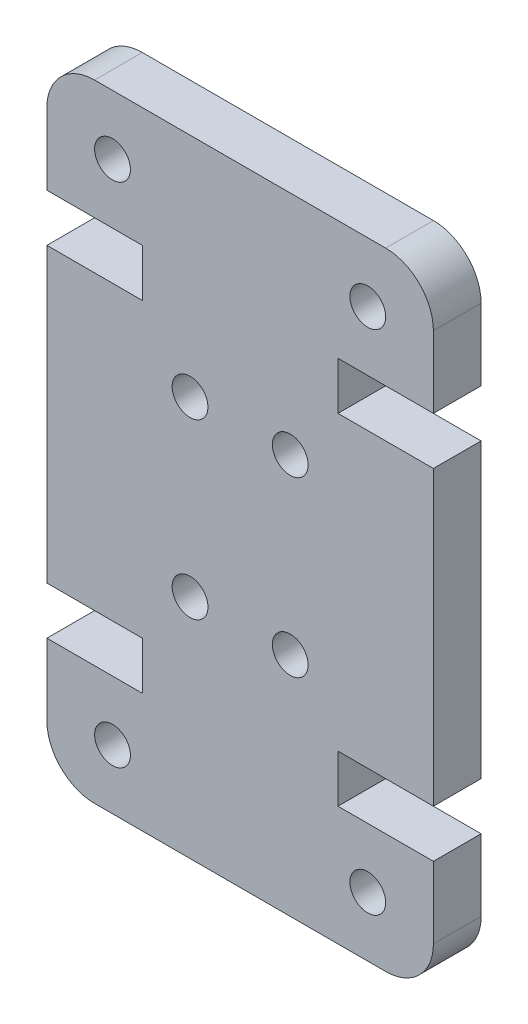
from build123d import *

# Parameters (mm, degrees)
SKETCH2_R           = 0.75
BOSS_EXTRUDE1_DEPTH = 2


with BuildPart() as part:
    # Sketch2 → Boss-Extrude1 (new body)
    with BuildSketch(Plane.XY):
        with BuildLine():
            Line((0, 7), (0, 19.26))
            Line((0, 19.26), (4, 19.26))
            Line((4, 19.26), (4, 21.26))
            Line((4, 21.26), (0, 21.26))
            Line((0, 21.26), (0, 24.26))
            ThreePointArc((0, 24.26), (0.585786438, 25.674213562), (2, 26.26))
            Line((2, 26.26), (14.2, 26.26))
            ThreePointArc((14.2, 26.26), (15.614213562, 25.674213562), (16.2, 24.26))
            Line((16.2, 24.26), (16.2, 21.26))
            Line((16.2, 21.26), (12.2, 21.26))
            Line((12.2, 21.26), (12.2, 19.26))
            Line((12.2, 19.26), (16.2, 19.26))
            Line((16.2, 19.26), (16.2, 7))
            Line((16.2, 7), (12.2, 7))
            Line((12.2, 7), (12.2, 5))
            Line((12.2, 5), (16.2, 5))
            Line((16.2, 5), (16.2, 2))
            ThreePointArc((16.2, 2), (15.614213562, 0.585786438), (14.2, 0))
            Line((14.2, 0), (2, 0))
            ThreePointArc((2, 0), (0.585786438, 0.585786438), (0, 2))
            Line((0, 2), (0, 5))
            Line((0, 5), (4, 5))
            Line((4, 5), (4, 7))
            Line((4, 7), (0, 7))
        make_face()
        with Locations((13.45, 2.5)):
            Circle(SKETCH2_R, mode=Mode.SUBTRACT)
        with Locations((10.2, 9.5)):
            Circle(SKETCH2_R, mode=Mode.SUBTRACT)
        with Locations((2.75, 23.76)):
            Circle(SKETCH2_R, mode=Mode.SUBTRACT)
        with Locations((6, 16.76)):
            Circle(SKETCH2_R, mode=Mode.SUBTRACT)
        with Locations((10.2, 16.76)):
            Circle(SKETCH2_R, mode=Mode.SUBTRACT)
        with Locations((13.45, 23.76)):
            Circle(SKETCH2_R, mode=Mode.SUBTRACT)
        with Locations((6, 9.5)):
            Circle(SKETCH2_R, mode=Mode.SUBTRACT)
        with Locations((2.75, 2.5)):
            Circle(SKETCH2_R, mode=Mode.SUBTRACT)
    extrude(amount=BOSS_EXTRUDE1_DEPTH)


solid = part.part
